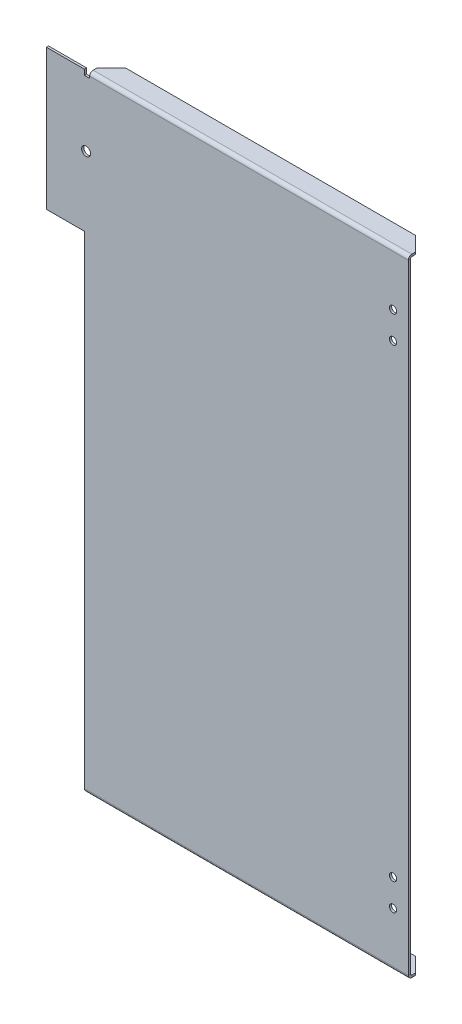
from build123d import *

# Parameters (mm, degrees)
SM_BASE_FLANGE_1_DEPTH             = 1.2
SKETCH_6_R                         = 2.5
CUT_EXTRUDE_1_DEPTH                = 10
SKETCH_7_R                         = 2
CUT_EXTRUDE_2_DEPTH                = 10
SKETCH_8_W                         = 3
SKETCH_8_H                         = 3
CUT_EXTRUDE_3_DEPTH                = 10
SM_EDGE_FLANGE_1_STRIP_W           = 6.2732
SM_EDGE_FLANGE_1_STRIP_H           = 1.2
SM_EDGE_FLANGE_1_STRIP_CUT_DEPTH   = 177
SM_EDGE_FLANGE_1_STRIP_2_W         = 6.2732
SM_EDGE_FLANGE_1_STRIP_2_H         = 1.2
SM_EDGE_FLANGE_1_STRIP_CUT_2_DEPTH = 180
SM_EDGE_FLANGE_1_DEPTH             = 177
SM_EDGE_FLANGE_1_BEND_DEPTH        = 180
CHAMFER_1_SIZE                     = 8


# Sheet-metal steps are written as plain solids
with BuildPart() as part:
    # Sketch 1 → Базовая кромка1 (new body)
    with BuildSketch(Plane.XY):
        Polygon((0, 270), (-21, 270), (-21, 348), (180, 348), (180, 0), (0, 0), align=None)
    extrude(amount=-SM_BASE_FLANGE_1_DEPTH)

    # Эскиз6 → Вырез-Вытянуть1 (cut)
    with BuildSketch(Plane.XY):
        with Locations((1, 309)):
            Circle(SKETCH_6_R)
    extrude(amount=-CUT_EXTRUDE_1_DEPTH, mode=Mode.SUBTRACT)

    # Эскиз7 → Вырез-Вытянуть2 (cut)
    with BuildSketch(Plane.XY):
        with Locations((171.5, 318)):
            Circle(SKETCH_7_R)
        with Locations((171.5, 303)):
            Circle(SKETCH_7_R)
        with Locations((171.5, 45)):
            Circle(SKETCH_7_R)
        with Locations((171.5, 30)):
            Circle(SKETCH_7_R)
    extrude(amount=-CUT_EXTRUDE_2_DEPTH, mode=Mode.SUBTRACT)

    # Эскиз8 → Вырез-Вытянуть3 (cut)
    with BuildSketch(Plane.XY):
        with Locations((1.5, 346.5)):
            Rectangle(SKETCH_8_W, SKETCH_8_H)
    extrude(amount=-CUT_EXTRUDE_3_DEPTH, mode=Mode.SUBTRACT)

    # Ребро-кромка1 strip (across the edge) → Ребро-кромка1 strip cut (cut)
    with BuildSketch(Plane(origin=(3, 348, -1.2), x_dir=(0, -1, 0), z_dir=(1, 0, 0))):
        with Locations((-1.2, -0.6)):
            Rectangle(SM_EDGE_FLANGE_1_STRIP_W, SM_EDGE_FLANGE_1_STRIP_H)
    extrude(amount=SM_EDGE_FLANGE_1_STRIP_CUT_DEPTH, mode=Mode.SUBTRACT)

    # Ребро-кромка1 strip 2 (across the edge) → Ребро-кромка1 strip cut 2 (cut)
    with BuildSketch(Plane(origin=(180, 0, -1.2), x_dir=(0, 1, 0), z_dir=(-1, 0, 0))):
        with Locations((-1.2, -0.6)):
            Rectangle(SM_EDGE_FLANGE_1_STRIP_2_W, SM_EDGE_FLANGE_1_STRIP_2_H)
    extrude(amount=SM_EDGE_FLANGE_1_STRIP_CUT_2_DEPTH, mode=Mode.SUBTRACT)

    # Ребро-кромка1 section (across the edge) → Ребро-кромка1 (add)
    with BuildSketch(Plane(origin=(3, 348, -1.2), x_dir=(0, -1, 0), z_dir=(1, 0, 0))):
        with BuildLine():
            Line((0, 0.7366), (0, 10.8))
            Line((0, 10.8), (1.2, 10.8))
            Line((1.2, 10.8), (1.2, 0.7366))
            ThreePointArc((1.2, 0.7366), (1.415745145, 0.215745145), (1.9366, 0))
            Line((1.9366, 0), (1.9366, -1.2))
            ThreePointArc((1.9366, -1.2), (0.567217008, -0.632782992), (0, 0.7366))
        make_face()
    extrude(amount=SM_EDGE_FLANGE_1_DEPTH)

    # Ребро-кромка1 section 2 (across the edge) → Ребро-кромка1 bend (add)
    with BuildSketch(Plane(origin=(180, 0, -1.2), x_dir=(0, 1, 0), z_dir=(-1, 0, 0))):
        with BuildLine():
            Line((0, 0.7366), (0, 10.8))
            Line((0, 10.8), (1.2, 10.8))
            Line((1.2, 10.8), (1.2, 0.7366))
            ThreePointArc((1.2, 0.7366), (1.415745145, 0.215745145), (1.9366, 0))
            Line((1.9366, 0), (1.9366, -1.2))
            ThreePointArc((1.9366, -1.2), (0.567217008, -0.632782992), (0, 0.7366))
        make_face()
    extrude(amount=SM_EDGE_FLANGE_1_BEND_DEPTH)

    # Фаска1
    chamfer_1_edges = [part.edges().sort_by_distance(p)[0] for p in [
        (3, 347.4, -12),
        (180, 347.4, -12),
        (180, 0.6, -12),
        (0, 0.6, -12),
    ]]
    chamfer(chamfer_1_edges, length=CHAMFER_1_SIZE)


solid = part.part
